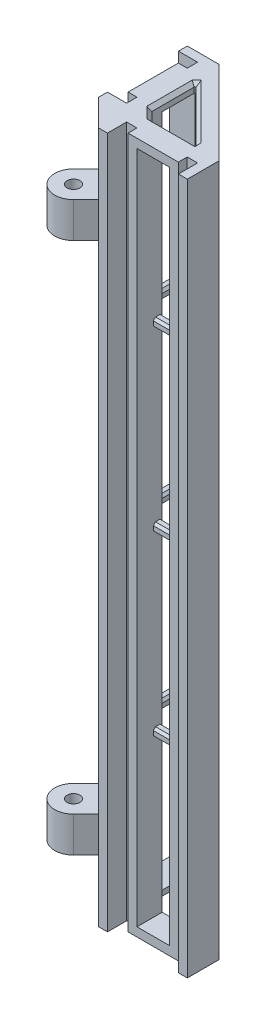
from build123d import *

# Parameters (mm, degrees)
BOSS_EXTRUDE4_DEPTH      = 247.65
CUT_EXTRUDE9_DEPTH       = 247.65
SKETCH11_W               = 11.65
SKETCH11_H               = 241.3
CUT_EXTRUDE7_DEPTH       = 9.017
SKETCH12_W               = 11.65
SKETCH12_H               = 241.3
CUT_EXTRUDE8_DEPTH       = 9.017
SKETCH16_R               = 2.286
BOSS_EXTRUDE5_DEPTH      = 12.7
CHAMFER1_SIZE            = 0.493914087
CHAMFER1_SIZE_2          = 0.6985
CHAMFER2_SIZE            = 3.175
CHAMFER3_SIZE            = 1.27
BOSS_EXTRUDE6_DEPTH      = 1.5875
BOSS_EXTRUDE6_DEPTH_BACK = 1.5875
SKETCH19_W               = 11.65
SKETCH19_H               = 3.175
SKETCH19_W_2             = 3.175
SKETCH19_H_2             = 11.4765
SKETCH20_W               = 3.175
SKETCH20_H               = 11.4765
SKETCH20_W_2             = 11.65
SKETCH20_H_2             = 3.175
BOSS_EXTRUDE7_DEPTH      = 3.175
CHAMFER4_SIZE            = 0.79375


with BuildPart() as part:
    # Sketch1 → Boss-Extrude4 (new body)
    with BuildSketch(Plane(origin=(0, 0, 0), x_dir=(1, 0, 0), z_dir=(0, 1, 0))):
        Polygon((41.275, 0), (41.275, 11.384871939), (11.384871939, 41.275), (0, 41.275), (0, 38.1), (6.858, 38.1), (6.858, 34.4), (3.683, 34.4), (3.683, 16.4), (6.858, 16.4), (6.858, 12.7), (0, 12.7), (0, 9.525), (9.525, 0), (12.7, 0), (12.7, 6.858), (16.4, 6.858), (16.4, 3.683), (34.4, 3.683), (34.4, 6.858), (38.1, 6.858), (38.1, 0), align=None)
    extrude(amount=BOSS_EXTRUDE4_DEPTH)

    # Sketch13 → Cut-Extrude9 (cut)
    with BuildSketch(Plane.XZ):
        Polygon((12.7, -12.7), (12.7, -31.75), (31.75, -12.7), align=None)
    extrude(amount=-CUT_EXTRUDE9_DEPTH, mode=Mode.SUBTRACT)

    # Sketch11 → Cut-Extrude7 (cut)
    with BuildSketch(Plane.ZY.offset(-3.683)):
        with Locations((-25.4, 123.825)):
            Rectangle(SKETCH11_W, SKETCH11_H)
    extrude(amount=-CUT_EXTRUDE7_DEPTH, mode=Mode.SUBTRACT)

    # Sketch12 → Cut-Extrude8 (cut)
    with BuildSketch(Plane.XY.offset(-3.683)):
        with Locations((25.4, 123.825)):
            Rectangle(SKETCH12_W, SKETCH12_H)
    extrude(amount=-CUT_EXTRUDE8_DEPTH, mode=Mode.SUBTRACT)

    # Sketch16 → Boss-Extrude5 (add)
    with BuildSketch(Plane(origin=(0, 225.425, 0), x_dir=(1, 0, 0), z_dir=(0, 1, 0))):
        with BuildLine():
            Line((5.034871939, -4.490128061), (9.525, 0))
            Line((9.525, 0), (0, 9.525))
            Line((0, 9.525), (-4.490128061, 5.034871939))
            ThreePointArc((-4.490128061, 5.034871939), (-4.490128061, -4.490128061), (5.034871939, -4.490128061))
        make_face()
        with Locations(Location((0.272371939, 0.272371939, 0), (0, 0, 270))):
            Circle(SKETCH16_R, mode=Mode.SUBTRACT)
    boss_extrude5 = extrude(amount=-BOSS_EXTRUDE5_DEPTH)

    # Mirror1: Boss-Extrude5 across plane
    add(boss_extrude5.mirror(Plane.ZX.offset(123.825)))

    # Chamfer1
    # the kernel refuses this chamfer: 0.6985, 0.493914087 mm, written as the material it adds along each edge
    with BuildSketch(Plane(origin=(31.75, 0, -12.7), x_dir=(-0.9984038297885895, 0, 0.056478249472492296), z_dir=(0, 1, 0))) as chamfer1_piece_1:
        Polygon((CHAMFER1_SIZE * 0.998403829099, -CHAMFER1_SIZE * 0.0564782494335), (CHAMFER1_SIZE_2 * 0.666041965215, -CHAMFER1_SIZE_2 * 0.745914271598), (0, 0), align=None)
    extrude(amount=247.65)
    with BuildSketch(Plane(origin=(12.7, 0, -31.75), x_dir=(0.745914271597676, 0, 0.6660419652145867), z_dir=(0, 1, 0))) as chamfer1_piece_2_section:
        Polygon((CHAMFER1_SIZE * 0.998403829099, -CHAMFER1_SIZE * 0.0564782494335), (CHAMFER1_SIZE_2 * 0.666041965215, -CHAMFER1_SIZE_2 * 0.745914271598), (0, 0), align=None)
    chamfer1_piece_2 = extrude(amount=247.65, mode=Mode.PRIVATE)
    chamfer1_piece_2 = split(chamfer1_piece_2, bisect_by=Plane(origin=(12.824663098, 1.5875, -31.225), z_dir=(0, 0, -1)), keep=Keep.TOP, mode=Mode.PRIVATE)
    add(chamfer1_piece_2)
    with BuildSketch(Plane(origin=(12.7, 0, -31.75), x_dir=(0.745914271597676, 0, 0.6660419652145867), z_dir=(0, 1, 0))) as chamfer1_piece_3_section:
        Polygon((CHAMFER1_SIZE * 0.998403829099, -CHAMFER1_SIZE * 0.0564782494335), (CHAMFER1_SIZE_2 * 0.666041965215, -CHAMFER1_SIZE_2 * 0.745914271598), (0, 0), align=None)
    chamfer1_piece_3 = extrude(amount=249.446320567, mode=Mode.PRIVATE)
    chamfer1_piece_3 = split(chamfer1_piece_3, bisect_by=Plane(origin=(12.757833333, 3.175, -31.167166667), z_dir=(0, -1, 0)), keep=Keep.TOP, mode=Mode.PRIVATE)
    add(chamfer1_piece_3)
    with BuildSketch(Plane(origin=(12.7, -1.796320567, -31.75), x_dir=(0.745914271597676, 0, 0.6660419652145867), z_dir=(0, 1, 0))) as chamfer1_piece_4_section:
        Polygon((CHAMFER1_SIZE * 0.998403829099, -CHAMFER1_SIZE * 0.0564782494335), (CHAMFER1_SIZE_2 * 0.666041965215, -CHAMFER1_SIZE_2 * 0.745914271598), (0, 0), align=None)
    chamfer1_piece_4 = extrude(amount=249.446320567, mode=Mode.PRIVATE)
    chamfer1_piece_4 = split(chamfer1_piece_4, bisect_by=Plane(origin=(12.757833333, 244.475, -31.167166667), z_dir=(0, 1, 0)), keep=Keep.TOP, mode=Mode.PRIVATE)
    add(chamfer1_piece_4)

    # Chamfer2
    chamfer2_edges = [part.edges().sort_by_distance(p)[0] for p in [
        (12.7, 123.825, -12.7),
    ]]
    chamfer(chamfer2_edges, length=CHAMFER2_SIZE)

    # Chamfer3
    chamfer3_edges = [part.edges().sort_by_distance(p)[0] for p in [
        (22.152667957, 0, -22.297332043),
        (22.152667957, 247.65, -22.297332043),
        (23.565542957, 0, -12.7),
        (23.565542957, 247.65, -12.7),
        (12.874625, 0, -31.226125),
        (12.874625, 247.65, -31.226125),
        (31.256085913, 0, -12.946957043),
        (31.256085913, 247.65, -12.946957043),
        (12.7, 0, -23.46325),
        (12.7, 247.65, -23.46325),
        (14.2875, 0, -14.2875),
        (14.2875, 247.65, -14.2875),
    ]]
    chamfer(chamfer3_edges, length=CHAMFER3_SIZE)

    # Sketch19 → Boss-Extrude6 (add, two sides: drawn at the far end of the back side and taken through both)
    with BuildSketch(Plane(origin=(0, 123.825, 0), x_dir=(1, 0, 0), z_dir=(0, 1, 0)).offset(-BOSS_EXTRUDE6_DEPTH_BACK)):
        with Locations((25.4, 11.1125)):
            Rectangle(SKETCH19_W, SKETCH19_H)
        with Locations((11.1125, 25.31325)):
            Rectangle(SKETCH19_W_2, SKETCH19_H_2)
    extrude(amount=BOSS_EXTRUDE6_DEPTH + BOSS_EXTRUDE6_DEPTH_BACK)

    # Sketch20 → Boss-Extrude7 (add)
    with BuildSketch(Plane(origin=(0, 185.7375, 0), x_dir=(1, 0, 0), z_dir=(0, 1, 0))):
        with Locations((11.1125, 25.31325)):
            Rectangle(SKETCH20_W, SKETCH20_H)
        with Locations((25.4, 11.1125)):
            Rectangle(SKETCH20_W_2, SKETCH20_H_2)
    boss_extrude7 = extrude(amount=BOSS_EXTRUDE7_DEPTH)

    # Mirror2: Boss-Extrude7 across plane
    add(boss_extrude7.mirror(Plane.ZX.offset(123.825)))

    # Chamfer4
    chamfer4_edges = [part.edges().sort_by_distance(p)[0] for p in [
        (25.4, 122.2375, -12.7),
        (25.4, 122.2375, -9.525),
        (25.4, 125.4125, -9.525),
        (25.4, 125.4125, -12.7),
        (9.525, 122.2375, -25.31325),
        (12.7, 122.2375, -25.31325),
        (12.7, 125.4125, -25.31325),
        (9.525, 125.4125, -25.31325),
        (9.525, 185.7375, -25.31325),
        (12.7, 185.7375, -25.31325),
        (9.525, 188.9125, -25.31325),
        (12.7, 188.9125, -25.31325),
        (25.4, 185.7375, -12.7),
        (25.4, 185.7375, -9.525),
        (25.4, 188.9125, -12.7),
        (25.4, 188.9125, -9.525),
        (9.525, 58.7375, -25.31325),
        (12.7, 58.7375, -25.31325),
        (9.525, 61.9125, -25.31325),
        (12.7, 61.9125, -25.31325),
        (25.4, 58.7375, -12.7),
        (25.4, 58.7375, -9.525),
        (25.4, 61.9125, -12.7),
        (25.4, 61.9125, -9.525),
    ]]
    chamfer(chamfer4_edges, length=CHAMFER4_SIZE)


solid = part.part
